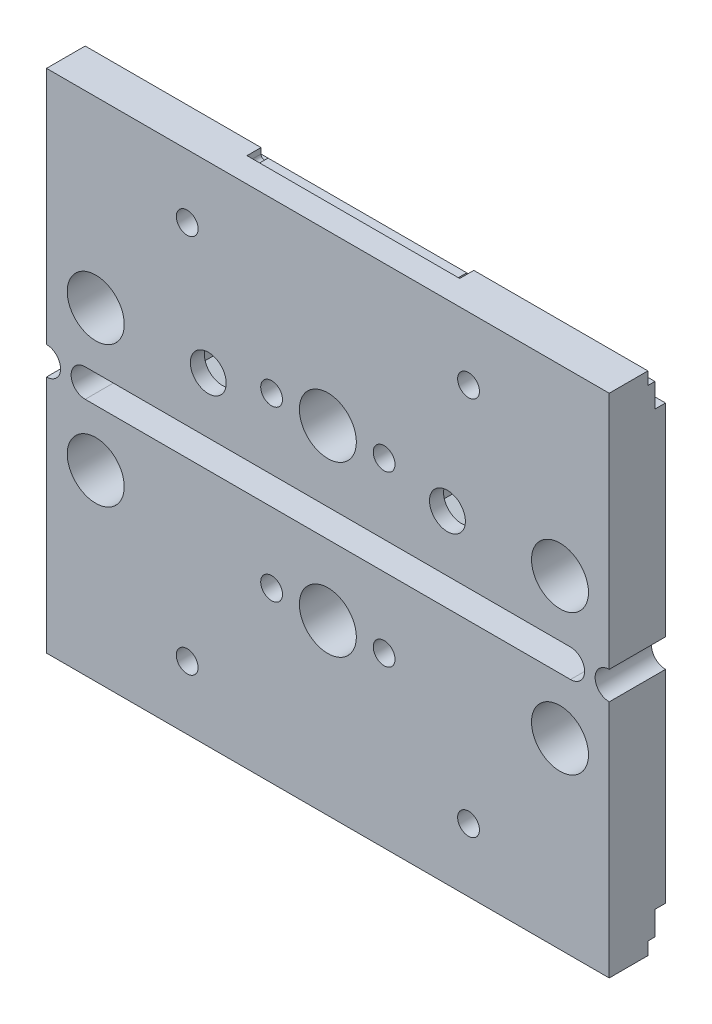
from build123d import *

# Parameters (mm, degrees)
SKETCH_2_W           = 80
SKETCH_2_H           = 34
SKETCH_2_R           = 4.05
EXTRUDE_1_DEPTH      = 8
SKETCH_3_R           = 2.55
CUT_EXTRUDE_1_DEPTH  = 88.292611371
CUT_EXTRUDE_2_DEPTH  = 88.292611371
SKETCH_5_R           = 1.55
CUT_EXTRUDE_3_DEPTH  = 88.292611371
CUT_EXTRUDE_4_DEPTH  = 6
CUT_EXTRUDE_5_DEPTH  = 4.5
SKETCH_25_R          = 1.55
CUT_EXTRUDE_13_DEPTH = 88.292611371
CUT_EXTRUDE_11_DEPTH = 2
EXTRUDE_2_DEPTH      = 8


with BuildPart() as part:
    # 草图2 → 凸台-拉伸1 (new body)
    with BuildSketch(Plane.XY):
        with Locations((40, 17)):
            Rectangle(SKETCH_2_W, SKETCH_2_H)
        with Locations((7, 8)):
            Circle(SKETCH_2_R, mode=Mode.SUBTRACT)
        with Locations((40, 10)):
            Circle(SKETCH_2_R, mode=Mode.SUBTRACT)
        with Locations((73, 8)):
            Circle(SKETCH_2_R, mode=Mode.SUBTRACT)
    extrude_1 = extrude(amount=EXTRUDE_1_DEPTH)

    # 草图3 → 切除-拉伸1 (cut, through all)
    with BuildSketch(Plane.XY.offset(8)):
        with Locations((23, 8)):
            Circle(SKETCH_3_R)
        with Locations((57, 8)):
            Circle(SKETCH_3_R)
    extrude(amount=-CUT_EXTRUDE_1_DEPTH, mode=Mode.SUBTRACT)

    # 草图4 → 切除-拉伸2 (cut, through all)
    with BuildSketch(Plane(origin=(80, 0, 0), x_dir=(0, 0, -1), z_dir=(1, 0, 0))):
        Polygon((-1.5, 32.2), (-2.5, 32.2), (-2.5, 34), (0, 34), (0, 28.8), (-1.5, 28.8), align=None)
    cut_extrude_2 = extrude(amount=-CUT_EXTRUDE_2_DEPTH, mode=Mode.SUBTRACT)

    # 草图5 → 切除-拉伸3 (cut, through all)
    with BuildSketch(Plane.XY.offset(8)):
        with Locations((48, 10)):
            Circle(SKETCH_5_R)
        with Locations((32, 10)):
            Circle(SKETCH_5_R)
    cut_extrude_3 = extrude(amount=-CUT_EXTRUDE_3_DEPTH, mode=Mode.SUBTRACT)

    # 草图7 → 切除-拉伸4 (cut)
    with BuildSketch(Plane(origin=(0, 0, 0), x_dir=(-1, 0, 0), z_dir=(0, 0, -1))):
        Polygon((-52.9, 5.632863896), (-52.9, 10.367136104), (-57, 12.734272207), (-61.1, 10.367136104), (-61.1, 5.632863896), (-57, 3.265727793), align=None)
        Polygon((-27.1, 5.632863896), (-23, 3.265727793), (-18.9, 5.632863896), (-18.9, 10.367136104), (-23, 12.734272207), (-27.1, 10.367136104), align=None)
    extrude(amount=-CUT_EXTRUDE_4_DEPTH, mode=Mode.SUBTRACT)

    # 草图8 → 切除-拉伸5 (cut)
    with BuildSketch(Plane(origin=(0, 0, 0), x_dir=(-1, 0, 0), z_dir=(0, 0, -1))):
        Polygon((-48, 6.709103466), (-45.15, 8.354551733), (-45.15, 11.645448267), (-48, 13.290896534), (-50.85, 11.645448267), (-50.85, 8.354551733), align=None)
        Polygon((-32, 6.709103466), (-29.15, 8.354551733), (-29.15, 11.645448267), (-32, 13.290896534), (-34.85, 11.645448267), (-34.85, 8.354551733), align=None)
    cut_extrude_5 = extrude(amount=-CUT_EXTRUDE_5_DEPTH, mode=Mode.SUBTRACT)

    # 草图25 → 切除-拉伸13 (cut, through all)
    with BuildSketch(Plane(origin=(0, 0, 0), x_dir=(-1, 0, 0), z_dir=(0, 0, -1))):
        with Locations((-60, 25)):
            Circle(SKETCH_25_R)
        with Locations((-20, 25)):
            Circle(SKETCH_25_R)
    cut_extrude_13 = extrude(amount=-CUT_EXTRUDE_13_DEPTH, mode=Mode.SUBTRACT)

    # 草图19 → 切除-拉伸11 (cut)
    with BuildSketch(Plane(origin=(0, 0, 2.5), x_dir=(-1, 0, 0), z_dir=(0, 0, -1))):
        with BuildLine():
            Line((-25, 34), (-55.247938178, 34))
            Line((-55.247938178, 34), (-55.247938178, 33.2))
            ThreePointArc((-55.247938178, 33.2), (-54.747938178, 32.7), (-54.247938178, 33.2))
            Line((-54.247938178, 33.2), (-26, 33.2))
            ThreePointArc((-26, 33.2), (-25.5, 32.7), (-25, 33.2))
            Line((-25, 33.2), (-25, 34))
        make_face()
    cut_extrude_11 = extrude(amount=-CUT_EXTRUDE_11_DEPTH, mode=Mode.SUBTRACT)

    # 草图22 → 凸台-拉伸2 (add)
    with BuildSketch(Plane.XY.offset(8)):
        with BuildLine():
            Line((0, -4), (5.5, -4))
            ThreePointArc((5.5, -4), (3.5, -2), (5.5, 0))
            Line((5.5, 0), (0, 0))
            ThreePointArc((0, 0), (2, -2), (0, -4))
        make_face()
        with BuildLine():
            Line((80, 0), (74.5, 0))
            ThreePointArc((74.5, 0), (76.5, -2), (74.5, -4))
            Line((74.5, -4), (80, -4))
            ThreePointArc((80, -4), (78, -2), (80, 0))
        make_face()
    extrude(amount=-EXTRUDE_2_DEPTH)

    # 镜向2: 凸台-拉伸1, 切除-拉伸2, 切除-拉伸3, 切除-拉伸5, 切除-拉伸13, 切除-拉伸11 across plane
    add(extrude_1.mirror(Plane(origin=(0, -2, 0), x_dir=(0, 0, 1), z_dir=(0, -1, 0))))
    add(cut_extrude_2.mirror(Plane(origin=(0, -2, 0), x_dir=(0, 0, 1), z_dir=(0, -1, 0))), mode=Mode.SUBTRACT)
    add(cut_extrude_3.mirror(Plane(origin=(0, -2, 0), x_dir=(0, 0, 1), z_dir=(0, -1, 0))), mode=Mode.SUBTRACT)
    add(cut_extrude_5.mirror(Plane(origin=(0, -2, 0), x_dir=(0, 0, 1), z_dir=(0, -1, 0))), mode=Mode.SUBTRACT)
    add(cut_extrude_13.mirror(Plane(origin=(0, -2, 0), x_dir=(0, 0, 1), z_dir=(0, -1, 0))), mode=Mode.SUBTRACT)
    add(cut_extrude_11.mirror(Plane(origin=(0, -2, 0), x_dir=(0, 0, 1), z_dir=(0, -1, 0))), mode=Mode.SUBTRACT)


solid = part.part
